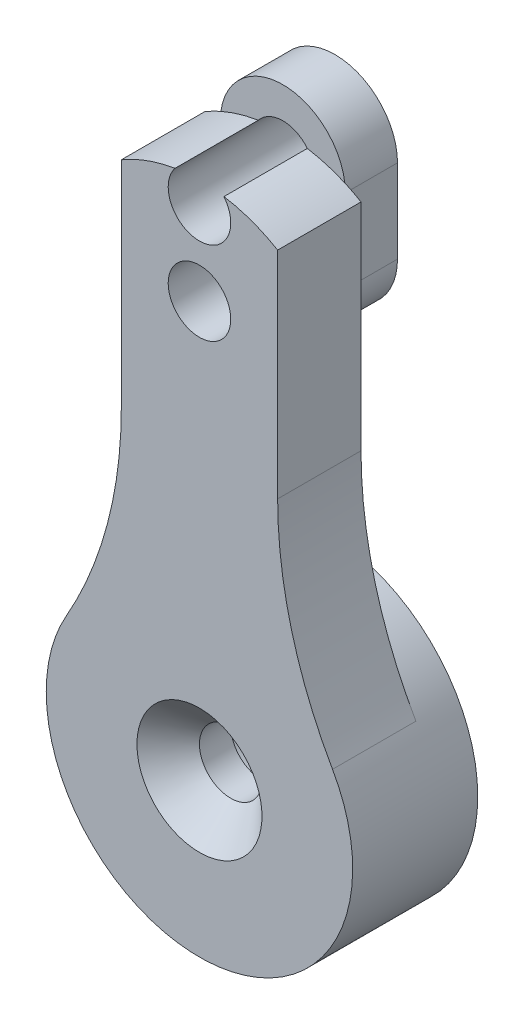
from build123d import *

# Parameters (mm, degrees)
SKETCH1_W                = 7.35
SKETCH1_H                = 6
BOSS_EXTRUDE1_DEPTH      = 4
BOSS_EXTRUDE2_DEPTH      = 2.5
F_3_0_3_DIAMETER_HOLE1_D = 3
FILLET1_R                = 20


# Read off the part's stored shape, not the designer's step: Boss-Extrude1
with BuildPart() as part:
    # Sketch1 → Revolve1 (revolve)
    with BuildSketch(Plane.XZ, mode=Mode.PRIVATE) as revolve1_sk:
        with Locations((3.675, 1)):
            Rectangle(SKETCH1_W, SKETCH1_H)
    revolve(revolve1_sk.sketch.rotate(Axis((0, 0, 4), (0, 0, -1)), 180), axis=Axis((0, 0, 4), (0, 0, -1)))

    # Boss-Extrude1 outline → Boss-Extrude1 (add)
    with BuildSketch(Plane.XY):
        with BuildLine():
            ThreePointArc((3.75, 23.9), (0, 24.928607748), (-3.75, 23.9))
            Line((-3.75, 23.9), (-3.75, 6.321392252))
            ThreePointArc((-3.75, 6.321392252), (0, 7.35), (3.75, 6.321392252))
            Line((3.75, 6.321392252), (3.75, 23.9))
        make_face()
    extrude(amount=BOSS_EXTRUDE1_DEPTH)

    # Sketch3 → Boss-Extrude2 (add)
    with BuildSketch(Plane(origin=(0, 0, 0), x_dir=(-1, 0, 0), z_dir=(0, 0, -1))):
        with BuildLine():
            Line((3, 23.9), (3, 19.9))
            ThreePointArc((3, 19.9), (0, 16.9), (-3, 19.9))
            Line((-3, 19.9), (-3, 23.9))
            ThreePointArc((-3, 23.9), (0, 26.9), (3, 23.9))
        make_face()
    extrude(amount=BOSS_EXTRUDE2_DEPTH)

    # Ø3.0 (3) Diameter Hole1 (through all)
    with Locations(Plane(origin=(0, 0, -2.5), x_dir=(-1, 0, 0), z_dir=(0, 0, -1))):
        with Locations((0, 23.9), (0, 19.9)):
            Hole(F_3_0_3_DIAMETER_HOLE1_D / 2)

    # Sketch6 → CBORE for M2.5 Hex Head Machine Screw1 (revolve, cut)
    with BuildSketch(Plane(origin=(0, 0, -2), x_dir=(0, 1, 0), z_dir=(1, 0, 0))):
        Polygon((0, 0), (0, 6), (3, 6), (1.5, 4.5), (1.5, 3), (3, 3), (3, 0), align=None)
    revolve(axis=Axis((0, 0, -8.35), (0, 0, 1)), mode=Mode.SUBTRACT)

    # Fillet1
    fillet1_edges = [part.edges().sort_by_distance(p)[0] for p in [
        (-3.75, 6.321392252, 2),
        (3.75, 6.321392252, 2),
    ]]
    fillet(fillet1_edges, radius=FILLET1_R)


solid = part.part
